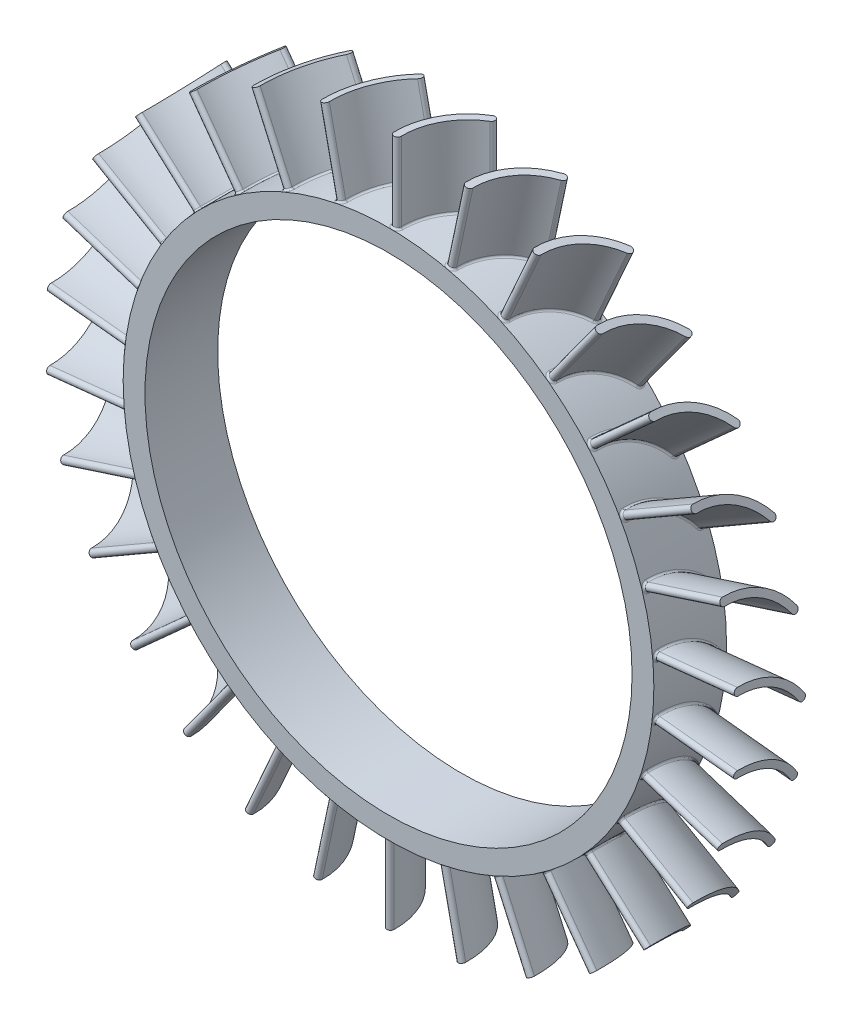
from build123d import *

# Parameters (mm, degrees)
SKETCH1_R                = 73
SKETCH1_R_2              = 67
BOSS_EXTRUDE1_DEPTH      = 10
BOSS_EXTRUDE2_START      = 68
BOSS_EXTRUDE2_DEPTH      = 27
FILLET1_R                = 0.5
CIRPATTERN1_COUNT        = 30
FILLET1_OF_CIRPATTERN1_R = 0.5


with BuildPart() as part:
    # Sketch1 → Boss-Extrude1 (new, symmetric)
    with BuildSketch(Plane.XY):
        Circle(SKETCH1_R)
        Circle(SKETCH1_R_2, mode=Mode.SUBTRACT)
    extrude(amount=BOSS_EXTRUDE1_DEPTH, both=True)

    # Sketch2 → Boss-Extrude2 (add)
    with BuildSketch(Plane(origin=(0, 0, 0), x_dir=(1, 0, 0), z_dir=(0, 1, 0)).offset(BOSS_EXTRUDE2_START)):
        with BuildLine():
            ThreePointArc((-0.015411203, -8.5), (2.48026862, 1.546814045), (9.664759511, 9))
            ThreePointArc((9.664759511, 9), (11.037278052, 8.659129273), (10.696407325, 7.286610731))
            ThreePointArc((10.696407325, 7.286610731), (4.230365523, 0.578743372), (1.984253683, -8.463389269))
            ThreePointArc((1.984253683, -8.463389269), (1.002726606, -9.481527077), (-0.015411203, -8.5))
        make_face()
    boss_extrude2 = extrude(amount=BOSS_EXTRUDE2_DEPTH)

    # Fillet1
    fillet1_edges = [part.edges().sort_by_distance(p)[0] for p in [
        (2.485414926, 72.957677557, -1.556111808),
        (2.485414926, 72.957677557, -1.556111808),
        (4.2367874, 72.876948583, -0.59034287),
        (1.002786497, 72.993112136, 9.481525977),
    ]]
    fillet(fillet1_edges, radius=FILLET1_R)

    # CirPattern1: Boss-Extrude2 ×30 about axis
    cirpattern1_axis = Axis((0, 0, 10), (0, 0, -1))
    for i in range(1, CIRPATTERN1_COUNT):
        add(boss_extrude2.rotate(cirpattern1_axis, i * 360 / CIRPATTERN1_COUNT))

    # Fillet1 of CirPattern1
    fillet1_of_cirpattern1_edges = [part.edges().sort_by_distance(p)[0] for p in [
        (17.599856746, 70.846630438, -1.556111808),
        (17.599856746, 70.846630438, -1.556111808),
        (19.296173031, 70.403534774, -0.59034287),
        (16.156994568, 71.18954647, 9.481525977),
        (31.945100372, 65.639245609, -1.556111808),
        (31.945100372, 65.639245609, -1.556111808),
        (33.512223308, 64.853148661, -0.59034287),
        (30.605064447, 66.274656017, 9.481525977),
        (44.894189823, 57.563110774, -1.556111808),
        (44.894189823, 57.563110774, -1.556111808),
        (46.263628617, 56.468368751, -0.59034287),
        (43.71554615, 58.463245076, 9.481525977),
        (55.881187752, 46.971191781, -1.556111808),
        (55.881187752, 46.971191781, -1.556111808),
        (56.993091358, 45.615650162, -0.59034287),
        (54.915448716, 48.096709787, 9.481525977),
        (64.425909628, 34.326406314, -1.556111808),
        (64.425909628, 34.326406314, -1.556111808),
        (65.231682523, 32.769308773, -0.59034287),
        (63.71528266, 35.628117487, 9.481525977),
        (70.154910104, 20.181392174, -1.556111808),
        (70.154910104, 20.181392174, -1.556111808),
        (70.619336146, 18.490791346, -0.59034287),
        (69.730453011, 21.60240549, 9.481525977),
        (72.817804368, 5.154354356, -1.556111808),
        (72.817804368, 5.154354356, -1.556111808),
        (72.92058591, 3.404137608, -0.59034287),
        (72.698067962, 6.632564713, 9.481525977),
        (72.298211163, -10.097953481, -1.556111808),
        (72.298211163, -10.097953481, -1.556111808),
        (72.034856158, -11.831293278, -0.59034287),
        (72.488428499, -8.627150968, 9.481525977),
        (68.618839204, -24.908932296, -1.556111808),
        (68.618839204, -24.908932296, -1.556111808),
        (68.00085753, -26.549639875, -0.59034287),
        (69.110696872, -23.509818755, 9.481525977),
        (61.940494702, -38.631271243, -1.556111808),
        (61.940494702, -38.631271243, -1.556111808),
        (60.994895124, -40.10763981, -0.59034287),
        (62.712496163, -37.364994649, 9.481525977),
        (52.555053359, -50.665238264, -1.556111808),
        (52.555053359, -50.665238264, -1.556111808),
        (51.323163115, -51.912743428, -0.59034287),
        (53.573458443, -49.58714098, 9.481525977),
        (40.872703996, -60.484891253, -1.556111808),
        (40.872703996, -60.484891253, -1.556111808),
        (39.408362602, -61.449011053, -0.59034287),
        (42.093003515, -59.642091305, 9.481525977),
        (27.40402134, -67.661064256, -1.556111808),
        (27.40402134, -67.661064256, -1.556111808),
        (25.771227541, -68.299662029, -0.59034287),
        (28.772882348, -67.090396045, 9.481525977),
        (12.737651452, -71.880124077, -1.556111808),
        (12.737651452, -71.880124077, -1.556111808),
        (11.007766172, -72.165290037, -0.59034287),
        (14.195248156, -71.606528542, 9.481525977),
        (-2.485414926, -72.957677557, -1.556111808),
        (-2.485414926, -72.957677557, -1.556111808),
        (-4.2367874, -72.876948583, -0.59034287),
        (-1.002786497, -72.993112136, 9.481525977),
        (-17.599856746, -70.846630438, -1.556111808),
        (-17.599856746, -70.846630438, -1.556111808),
        (-19.296173031, -70.403534774, -0.59034287),
        (-16.156994568, -71.18954647, 9.481525977),
        (-31.945100372, -65.639245609, -1.556111808),
        (-31.945100372, -65.639245609, -1.556111808),
        (-33.512223308, -64.853148661, -0.59034287),
        (-30.605064447, -66.274656017, 9.481525977),
        (-44.894189823, -57.563110774, -1.556111808),
        (-44.894189823, -57.563110774, -1.556111808),
        (-46.263628617, -56.468368751, -0.59034287),
        (-43.71554615, -58.463245076, 9.481525977),
        (-55.881187752, -46.971191781, -1.556111808),
        (-55.881187752, -46.971191781, -1.556111808),
        (-56.993091358, -45.615650162, -0.59034287),
        (-54.915448716, -48.096709787, 9.481525977),
        (-64.425909628, -34.326406314, -1.556111808),
        (-64.425909628, -34.326406314, -1.556111808),
        (-65.231682523, -32.769308773, -0.59034287),
        (-63.71528266, -35.628117487, 9.481525977),
        (-70.154910104, -20.181392174, -1.556111808),
        (-70.154910104, -20.181392174, -1.556111808),
        (-70.619336146, -18.490791346, -0.59034287),
        (-69.730453011, -21.60240549, 9.481525977),
        (-72.817804368, -5.154354356, -1.556111808),
        (-72.817804368, -5.154354356, -1.556111808),
        (-72.92058591, -3.404137608, -0.59034287),
        (-72.698067962, -6.632564713, 9.481525977),
        (-72.298211163, 10.097953481, -1.556111808),
        (-72.298211163, 10.097953481, -1.556111808),
        (-72.034856158, 11.831293278, -0.59034287),
        (-72.488428499, 8.627150968, 9.481525977),
        (-68.618839204, 24.908932296, -1.556111808),
        (-68.618839204, 24.908932296, -1.556111808),
        (-68.00085753, 26.549639875, -0.59034287),
        (-69.110696872, 23.509818755, 9.481525977),
        (-61.940494702, 38.631271243, -1.556111808),
        (-61.940494702, 38.631271243, -1.556111808),
        (-60.994895124, 40.10763981, -0.59034287),
        (-62.712496163, 37.364994649, 9.481525977),
        (-52.555053359, 50.665238264, -1.556111808),
        (-52.555053359, 50.665238264, -1.556111808),
        (-51.323163115, 51.912743428, -0.59034287),
        (-53.573458443, 49.58714098, 9.481525977),
        (-40.872703996, 60.484891253, -1.556111808),
        (-40.872703996, 60.484891253, -1.556111808),
        (-39.408362602, 61.449011053, -0.59034287),
        (-42.093003515, 59.642091305, 9.481525977),
        (-27.40402134, 67.661064256, -1.556111808),
        (-27.40402134, 67.661064256, -1.556111808),
        (-25.771227541, 68.299662029, -0.59034287),
        (-28.772882348, 67.090396045, 9.481525977),
        (-12.737651452, 71.880124077, -1.556111808),
        (-12.737651452, 71.880124077, -1.556111808),
        (-11.007766172, 72.165290037, -0.59034287),
        (-14.195248156, 71.606528542, 9.481525977),
    ]]
    fillet(fillet1_of_cirpattern1_edges, radius=FILLET1_OF_CIRPATTERN1_R)


solid = part.part
